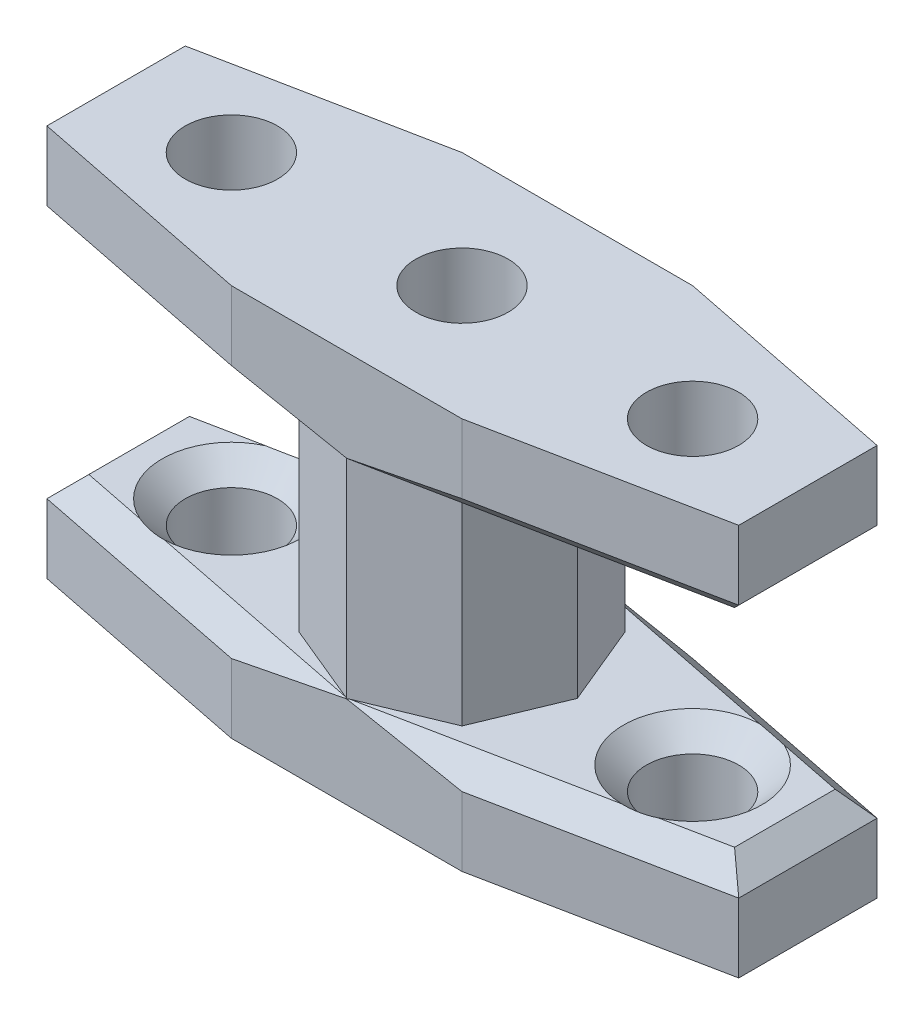
from build123d import *

# Parameters (mm, degrees)
SKETCH1_R               = 2
BOSS_EXTRUDE1_DEPTH     = 4
BOSS_EXTRUDE2_START     = 4
BOSS_EXTRUDE2_DEPTH     = 9
CHAMFER2_SIZE           = 1
CHAMFER3_SIZE           = 1
CUT_EXTRUDE2_DEPTH      = 10
CUT_EXTRUDE2_DEPTH_BACK = 9
SKETCH1_2_R             = 2
SKETCH6_R               = 2
CUT_EXTRUDE3_DEPTH      = 17


with BuildPart() as part:
    # Sketch1 → Boss-Extrude1 (new body)
    with BuildSketch(Plane(origin=(0, 0, 0), x_dir=(1, 0, 0), z_dir=(0, 1, 0))):
        Polygon((-5, -2.310289343), (5, -2.310289343), (15, -0.310289343), (15, 5.689710657), (5, 7.689710657), (-5, 7.689710657), (-15, 5.689710657), (-15, -0.310289343), align=None)
        with Locations(Location((10, 2.689710657, 0), (0, 0, 270))):
            Circle(SKETCH1_R, mode=Mode.SUBTRACT)
        with Locations(Location((0, 2.689710657, 0), (0, 0, 270))):
            Circle(SKETCH1_R, mode=Mode.SUBTRACT)
        with Locations(Location((-10, 2.689710657, 0), (0, 0, 90))):
            Circle(SKETCH1_R, mode=Mode.SUBTRACT)
    boss_extrude1 = extrude(amount=BOSS_EXTRUDE1_DEPTH)

    # Sketch2 → Boss-Extrude2 (add)
    with BuildSketch(Plane(origin=(0, 0, 0), x_dir=(1, 0, 0), z_dir=(0, 1, 0)).offset(BOSS_EXTRUDE2_START)):
        Polygon((0, -2.310289343), (3.535533906, -0.845823249), (5, 2.689710657), (3.535533906, 6.225244563), (0, 7.689710657), (-3.535533906, 6.225244563), (-5, 2.689710657), (-3.535533906, -0.845823249), align=None)
    extrude(amount=BOSS_EXTRUDE2_DEPTH)

    # Mirror1: Boss-Extrude1 across plane
    add(boss_extrude1.mirror(Plane.ZX.offset(8.5)))

    # Chamfer2
    # the kernel refuses this chamfer: 1 mm, written as the material it takes off along each edge
    with BuildSketch(Plane(origin=(17.521742642, 4, -5.185362128), x_dir=(-0.19611613513818452, 0, 0.9805806756909201), z_dir=(-0.9805806756909201, 0, -0.19611613513818454))) as chamfer2_piece_1_section:
        Polygon((CHAMFER2_SIZE, 0), (0, -CHAMFER2_SIZE), (0, 0), align=None)
    chamfer2_piece_1 = extrude(amount=20.484770979, mode=Mode.PRIVATE)
    chamfer2_piece_1 = split(chamfer2_piece_1, bisect_by=Plane(origin=(15.841163755, 4, -1.128085786), z_dir=(0.38268343236508956, 0, -0.9238795325112868)), keep=Keep.TOP, mode=Mode.PRIVATE)
    add(chamfer2_piece_1, mode=Mode.SUBTRACT)
    with BuildSketch(Plane(origin=(15, 4, 2.881972331), x_dir=(-1, 0, 0), z_dir=(0, 0, -1))) as chamfer2_piece_2:
        Polygon((CHAMFER2_SIZE, 0), (0, -CHAMFER2_SIZE), (0, 0), align=None)
    extrude(amount=11.143365976, mode=Mode.SUBTRACT)
    with BuildSketch(Plane(origin=(-2.565227926, 4, 3.823334929), x_dir=(0, -1, 0), z_dir=(0.9805806756909202, 0, -0.19611613513818407))) as chamfer2_piece_3_section:
        Polygon((CHAMFER2_SIZE, 0), (0, CHAMFER2_SIZE), (0, 0), align=None)
    chamfer2_piece_3 = extrude(amount=20.484770979, mode=Mode.PRIVATE)
    chamfer2_piece_3 = split(chamfer2_piece_3, bisect_by=Plane(origin=(-2.724501391, 4, 3.43881477), z_dir=(0.38268343236508995, 0, 0.9238795325112867)), keep=Keep.TOP, mode=Mode.PRIVATE)
    add(chamfer2_piece_3, mode=Mode.SUBTRACT)
    with BuildSketch(Plane(origin=(10, 4, -2.689710657), x_dir=(0, 0, 1), z_dir=(-1, 0, 0))) as chamfer2_piece_4:
        Polygon((2 + CHAMFER2_SIZE, 0), (2, -CHAMFER2_SIZE), (2, 0), align=None)
    revolve(axis=Axis((10, 4, -2.689710657), (0, 1, 0)), mode=Mode.SUBTRACT)
    with BuildSketch(Plane(origin=(-2.565227926, 13, 3.823334929), x_dir=(-0.19611613513818407, 0, -0.9805806756909202), z_dir=(0.9805806756909202, 0, -0.19611613513818407))) as chamfer2_piece_5_section:
        Polygon((CHAMFER2_SIZE, 0), (0, CHAMFER2_SIZE), (0, 0), align=None)
    chamfer2_piece_5 = extrude(amount=20.484770979, mode=Mode.PRIVATE)
    chamfer2_piece_5 = split(chamfer2_piece_5, bisect_by=Plane(origin=(-2.724501391, 13, 3.43881477), z_dir=(0.38268343236508995, 0, 0.9238795325112867)), keep=Keep.TOP, mode=Mode.PRIVATE)
    add(chamfer2_piece_5, mode=Mode.SUBTRACT)
    with BuildSketch(Plane(origin=(17.521742642, 13, -5.185362128), x_dir=(-0.19611613513818452, 0, 0.9805806756909201), z_dir=(-0.9805806756909201, 0, -0.19611613513818454))) as chamfer2_piece_6_section:
        Polygon((CHAMFER2_SIZE, 0), (0, CHAMFER2_SIZE), (0, 0), align=None)
    chamfer2_piece_6 = extrude(amount=20.484770979, mode=Mode.PRIVATE)
    chamfer2_piece_6 = split(chamfer2_piece_6, bisect_by=Plane(origin=(15.841163755, 13, -1.128085786), z_dir=(0.38268343236508956, 0, -0.9238795325112868)), keep=Keep.TOP, mode=Mode.PRIVATE)
    add(chamfer2_piece_6, mode=Mode.SUBTRACT)
    with BuildSketch(Plane(origin=(15, 13, 2.881972331), x_dir=(-1, 0, 0), z_dir=(0, 0, -1))) as chamfer2_piece_7:
        Polygon((CHAMFER2_SIZE, 0), (0, CHAMFER2_SIZE), (0, 0), align=None)
    extrude(amount=11.143365976, mode=Mode.SUBTRACT)

    # Chamfer3
    # the kernel refuses this chamfer: 1 mm, written as the material it takes off along each edge
    with BuildSketch(Plane(origin=(-10, 4, -2.689710657), x_dir=(0, 0, -1), z_dir=(1, 0, 0))) as chamfer3_piece_1:
        Polygon((2 + CHAMFER3_SIZE, 0), (2, -CHAMFER3_SIZE), (2, 0), align=None)
    revolve(axis=Axis((-10, 4, -2.689710657), (0, 1, 0)), mode=Mode.SUBTRACT)
    with BuildSketch(Plane(origin=(2.565227926, 13, -9.202756242), x_dir=(0.19611613513818496, 0, 0.98058067569092), z_dir=(-0.98058067569092, 0, 0.19611613513818493))) as chamfer3_piece_2_section:
        Polygon((CHAMFER3_SIZE, 0), (0, CHAMFER3_SIZE), (0, 0), align=None)
    chamfer3_piece_2 = extrude(amount=20.484770979, mode=Mode.PRIVATE)
    chamfer3_piece_2 = split(chamfer3_piece_2, bisect_by=Plane(origin=(2.724501391, 13, -8.818236083), z_dir=(-0.38268343236509006, 0, -0.9238795325112867)), keep=Keep.TOP, mode=Mode.PRIVATE)
    add(chamfer3_piece_2, mode=Mode.SUBTRACT)
    with BuildSketch(Plane(origin=(-15, 13, -8.261393645), x_dir=(1, 0, 0), z_dir=(0, 0, 1))) as chamfer3_piece_3:
        Polygon((CHAMFER3_SIZE, 0), (0, CHAMFER3_SIZE), (0, 0), align=None)
    extrude(amount=11.143365976, mode=Mode.SUBTRACT)
    with BuildSketch(Plane(origin=(-17.521742642, 13, -0.194059185), x_dir=(0.19611613513818402, 0, -0.9805806756909202), z_dir=(0.9805806756909202, 0, 0.19611613513818402))) as chamfer3_piece_4_section:
        Polygon((CHAMFER3_SIZE, 0), (0, CHAMFER3_SIZE), (0, 0), align=None)
    chamfer3_piece_4 = extrude(amount=20.484770979, mode=Mode.PRIVATE)
    chamfer3_piece_4 = split(chamfer3_piece_4, bisect_by=Plane(origin=(-15.841163755, 13, -4.251335528), z_dir=(-0.3826834323650897, 0, 0.9238795325112868)), keep=Keep.TOP, mode=Mode.PRIVATE)
    add(chamfer3_piece_4, mode=Mode.SUBTRACT)
    with BuildSketch(Plane(origin=(2.565227926, 4, -9.202756242), x_dir=(0.19611613513818496, 0, 0.98058067569092), z_dir=(-0.98058067569092, 0, 0.19611613513818493))) as chamfer3_piece_5_section:
        Polygon((CHAMFER3_SIZE, 0), (0, -CHAMFER3_SIZE), (0, 0), align=None)
    chamfer3_piece_5 = extrude(amount=20.484770979, mode=Mode.PRIVATE)
    chamfer3_piece_5 = split(chamfer3_piece_5, bisect_by=Plane(origin=(2.724501391, 4, -8.818236083), z_dir=(-0.38268343236509006, 0, -0.9238795325112867)), keep=Keep.TOP, mode=Mode.PRIVATE)
    add(chamfer3_piece_5, mode=Mode.SUBTRACT)
    with BuildSketch(Plane(origin=(-15, 4, -8.261393645), x_dir=(1, 0, 0), z_dir=(0, 0, 1))) as chamfer3_piece_6:
        Polygon((CHAMFER3_SIZE, 0), (0, -CHAMFER3_SIZE), (0, 0), align=None)
    extrude(amount=11.143365976, mode=Mode.SUBTRACT)
    with BuildSketch(Plane(origin=(-17.521742642, 4, -0.194059185), x_dir=(0.19611613513818402, 0, -0.9805806756909202), z_dir=(0.9805806756909202, 0, 0.19611613513818402))) as chamfer3_piece_7_section:
        Polygon((CHAMFER3_SIZE, 0), (0, -CHAMFER3_SIZE), (0, 0), align=None)
    chamfer3_piece_7 = extrude(amount=20.484770979, mode=Mode.PRIVATE)
    chamfer3_piece_7 = split(chamfer3_piece_7, bisect_by=Plane(origin=(-15.841163755, 4, -4.251335528), z_dir=(-0.3826834323650897, 0, 0.9238795325112868)), keep=Keep.TOP, mode=Mode.PRIVATE)
    add(chamfer3_piece_7, mode=Mode.SUBTRACT)

    # Sketch1<2> → Cut-Extrude2 (cut, two sides: drawn at the far end of the back side and taken through both)
    with BuildSketch(Plane(origin=(0, 0, 0), x_dir=(1, 0, 0), z_dir=(0, 1, 0)).offset(-CUT_EXTRUDE2_DEPTH_BACK)):
        with Locations(Location((0, 2.689710657, 0), (0, 0, 270))):
            Circle(SKETCH1_2_R)
    extrude(amount=CUT_EXTRUDE2_DEPTH + CUT_EXTRUDE2_DEPTH_BACK, mode=Mode.SUBTRACT)

    # Sketch6 → Cut-Extrude3 (cut)
    with BuildSketch(Plane(origin=(0, 13, 0), x_dir=(1, 0, 0), z_dir=(0, 1, 0))):
        with Locations(Location((0, 2.689710657, 0), (0, 0, 270))):
            Circle(SKETCH6_R)
    extrude(amount=-CUT_EXTRUDE3_DEPTH, mode=Mode.SUBTRACT)


solid = part.part
